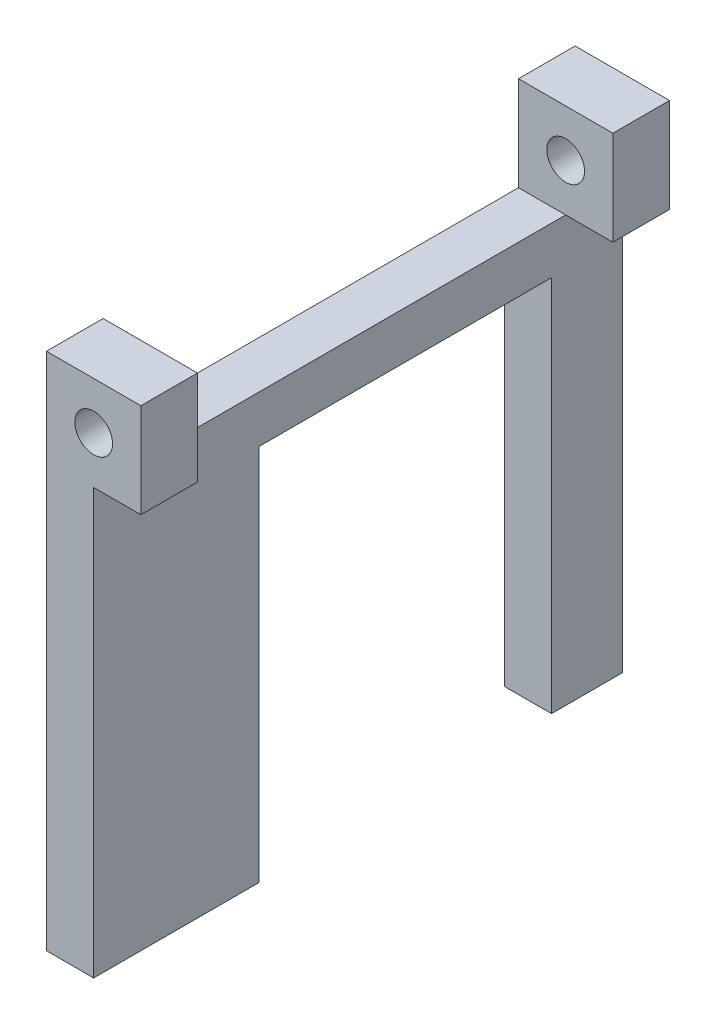
from build123d import *

# Parameters (mm, degrees)
EXTRUDE_2_DEPTH = 5
SKETCH_5_W      = 20
SKETCH_5_H      = 20
SKETCH_5_R      = 4
EXTRUDE_3_DEPTH = 12


with BuildPart() as part:
    # 草图3 → 凸台-拉伸2 (new, symmetric)
    with BuildSketch(Plane(origin=(0, 0, 0), x_dir=(0, 0, -1), z_dir=(1, 0, 0))):
        Polygon((41, 0), (56, 0), (56, 90), (-56, 90), (-56, 0), (-21, 0), (-21, 80), (41, 80), align=None)
    extrude(amount=EXTRUDE_2_DEPTH, both=True)

    # 草图5 → 凸台-拉伸3 (add)
    with BuildSketch(Plane.XY.offset(56)):
        with Locations((5, 100)):
            Rectangle(SKETCH_5_W, SKETCH_5_H)
        with Locations((5, 100)):
            Circle(SKETCH_5_R, mode=Mode.SUBTRACT)
    extrude_3 = extrude(amount=-EXTRUDE_3_DEPTH)

    # 镜向1: 凸台-拉伸3 across plane
    add(extrude_3.mirror(Plane.XY))


solid = part.part
